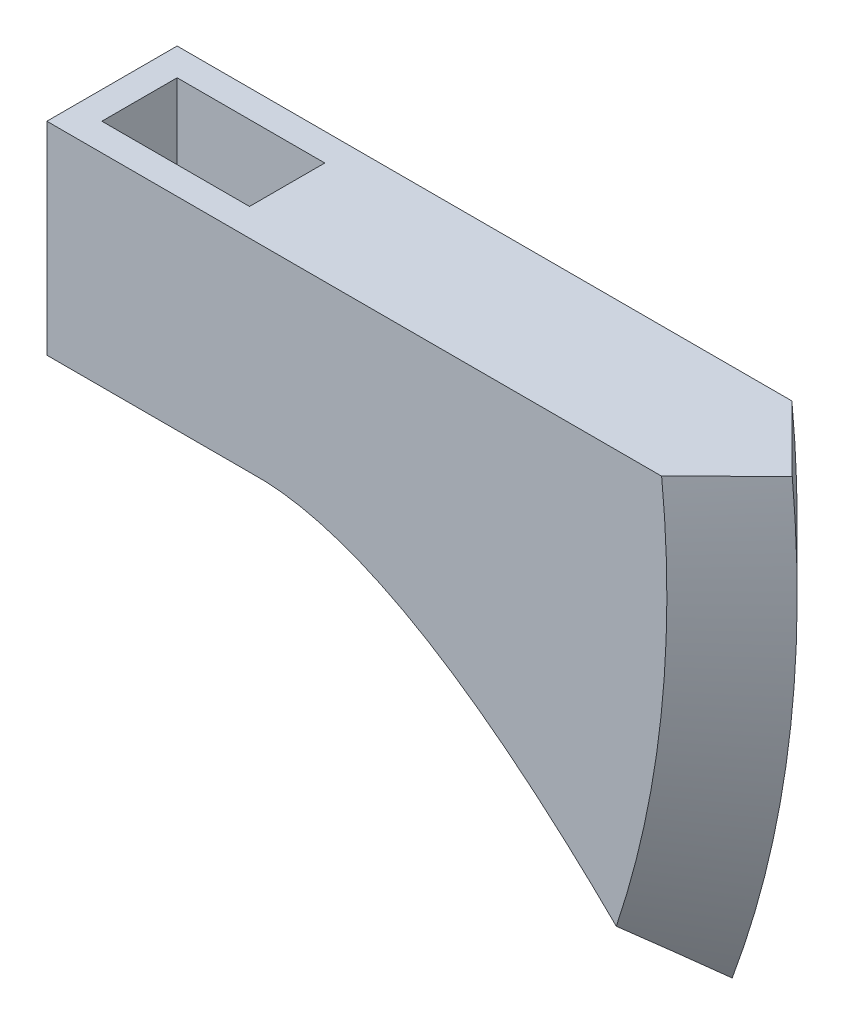
from build123d import *

# Parameters (mm, degrees)
BOSS_EXTRUDE1_DEPTH     = 9
CUT_EXTRUDE1_DEPTH      = 48.981771871
CUT_EXTRUDE1_DEPTH_BACK = 48.981771871
SKETCH2_W               = 10.2
SKETCH2_H               = 5.2
CHAMFER1_SIZE           = 5


with BuildPart() as part:
    # Sketch1 → Boss-Extrude1 (new body)
    with BuildSketch(Plane.XY):
        with BuildLine():
            Line((-34.136986301, -14), (-34.136986301, -28))
            Line((-34.136986301, -28), (-20.136986301, -28))
            add(Edge.make_bspline(
                [(-20.136986301, -28), (-8.577544678, -27.582757126), (9.091518621, -46.494870104)],
                knots=[0, 0, 0, 1, 1, 1], degree=2))
            ThreePointArc((9.091518621, -46.494870104), (13.07538723, -30.490408573), (13.358976811, -14))
            Line((13.358976811, -14), (-20.136986301, -14))
            Line((-20.136986301, -14), (-34.136986301, -14))
        make_face()
    extrude(amount=BOSS_EXTRUDE1_DEPTH)

    # Sketch2 → Cut-Extrude1 (cut, two sides: drawn at the far end of the back side and taken through both)
    with BuildSketch(Plane(origin=(0, -14, 0), x_dir=(1, 0, 0), z_dir=(0, 1, 0)).offset(-CUT_EXTRUDE1_DEPTH_BACK)):
        with Locations((-27.136986301, -4.5)):
            Rectangle(SKETCH2_W, SKETCH2_H)
    extrude(amount=CUT_EXTRUDE1_DEPTH + CUT_EXTRUDE1_DEPTH_BACK, mode=Mode.SUBTRACT)

    # Chamfer1
    # the kernel refuses this chamfer: 5 mm, written as the material it takes off along each edge
    with BuildSketch(Plane(origin=(-59.190017632, -21, 0), x_dir=(0.8608936735034536, -0.5087849083077534, 0), z_dir=(-0.5087849083077534, -0.8608936735034536, 0))) as chamfer1_piece_1:
        Polygon((72.885914927 - CHAMFER1_SIZE, 0), (72.885914927, CHAMFER1_SIZE), (72.885914927, 0), align=None)
    revolve(axis=Axis((-59.190017632, -21, 0), (0, 0, 1)), revolution_arc=46.202504034, mode=Mode.SUBTRACT)
    with BuildSketch(Plane(origin=(-59.190017632, -21, 9), x_dir=(0.8608936735034536, -0.5087849083077534, 0), z_dir=(-0.5087849083077534, -0.8608936735034536, 0))) as chamfer1_piece_2:
        Polygon((72.885914927 - CHAMFER1_SIZE, 0), (72.885914927, -CHAMFER1_SIZE), (72.885914927, 0), align=None)
    revolve(axis=Axis((-59.190017632, -21, 9), (0, 0, 1)), revolution_arc=46.202504034, mode=Mode.SUBTRACT)


solid = part.part
